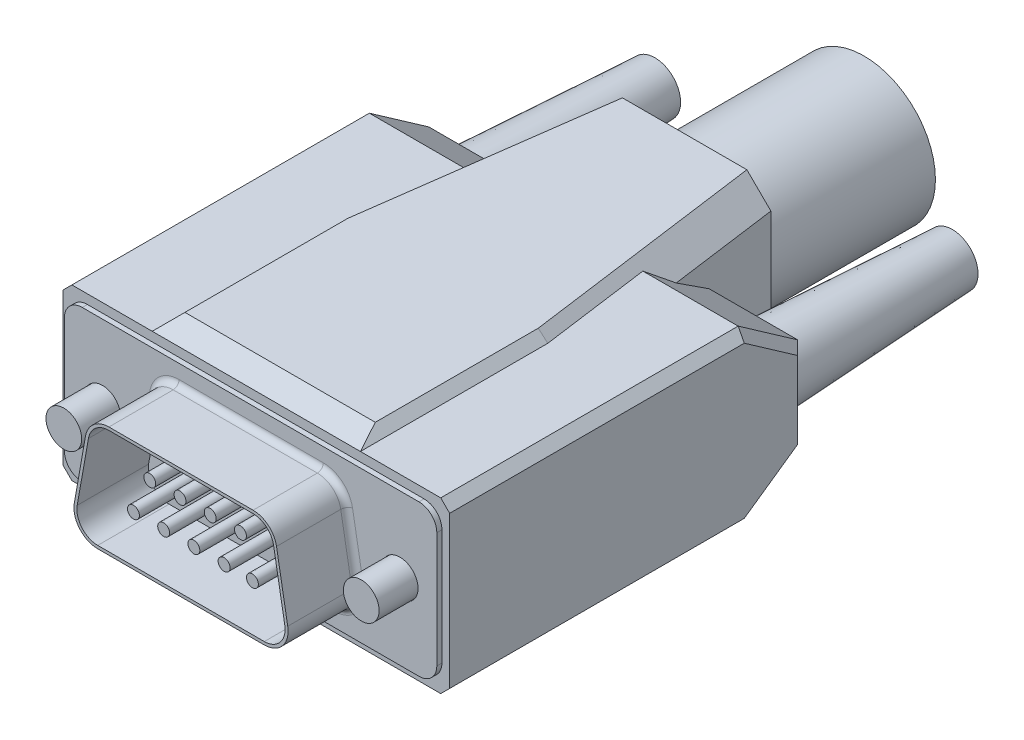
from build123d import *
from OCP.BRepFilletAPI import BRepFilletAPI_MakeChamfer

# Parameters (mm, degrees)
SKETCH1_W                        = 31.3
SKETCH1_H                        = 12.7
SKETCH1_R                        = 1.525
BASE_EXTRUDE_DEPTH               = 0.215
FILLET6_R                        = 1.5
BOSS_EXTRUDE2_DEPTH              = 5.9
FILLET8_R                        = 0.5
CUT_EXTRUDE1_DEPTH               = 6
SKETCH8_R                        = 0.5
BOSS_EXTRUDE3_DEPTH              = 5
LPATTERN1_COUNT                  = 4
LPATTERN1_PITCH                  = 2.54
SKETCH9_W                        = 32.5
SKETCH9_H                        = 14.25
BOSS_EXTRUDE4_DEPTH              = 30
SKETCH11_R                       = 2
CUT_EXTRUDE3_DEPTH               = 20
BOSS_EXTRUDE6_DEPTH              = 6
BOSS_EXTRUDE6_DEPTH_BACK         = 30
SKETCH12_W                       = 17.5
SKETCH12_H                       = 15.75
CHAMFER1_SIZE                    = 5
CHAMFER1_SIZE2                   = 3.5
CHAMFER3_SIZE                    = 11
CHAMFER3_SIZE_2                  = 1.5
CHAMFER4_SIZE                    = 2
CHAMFER6_SIZE                    = 0.75
CHAMFER7_SIZE                    = 0.75
CHAMFER7_SIZE2                   = 2
SKETCH18_R                       = 6
BOSS_EXTRUDE8_DEPTH              = 15.080000066
SKETCH20_R                       = 0.5
BOSS_EXTRUDE10_DEPTH             = 5
SKETCH22_R                       = 2
BOSS_EXTRUDE12_DEPTH             = 2
BOSS_EXTRUDE12_DIRECTION_2_REACH = 42.57
SKETCH21_R                       = 1.5
BOSS_EXTRUDE14_DEPTH             = 3.25
BOSS_EXTRUDE14_DIRECTION_2_REACH = 56.583
SKETCH23_R                       = 3
BOSS_EXTRUDE15_DEPTH             = 16
BOSS_EXTRUDE15_DRAFT             = 3
BOSS_EXTRUDE15_PROFILE_2_DEPTH   = 16
BOSS_EXTRUDE15_PROFILE_2_DRAFT   = 3


# Some blends are built 0.0001 mm under size
with BuildPart() as part:
    # Sketch1 → Base-Extrude (new, symmetric)
    with BuildSketch(Plane.XY):
        with Locations((-0.05, 0)):
            Rectangle(SKETCH1_W, SKETCH1_H)
        with Locations((12.5, 0)):
            Circle(SKETCH1_R, mode=Mode.SUBTRACT)
        with Locations(Location((-12.5, 0, 0), (0, 0, 180))):
            Circle(SKETCH1_R, mode=Mode.SUBTRACT)
    extrude(amount=BASE_EXTRUDE_DEPTH, both=True)

    # Fillet6
    fillet6_edges = [part.edges().sort_by_distance(p)[0] for p in [
        (-15.7, -6.35, 0),
        (15.6, -6.35, 0),
        (15.6, 6.35, 0),
        (-15.7, 6.35, 0),
    ]]
    fillet(fillet6_edges, radius=FILLET6_R)

    # Sketch4 → Boss-Extrude2 (add)
    with BuildSketch(Plane.XY.offset(0.215)):
        with BuildLine():
            Line((7, -4.67), (-7, -4.67))
            ThreePointArc((-7, -4.67), (-8.532088886, -3.955575219), (-8.969615506, -2.322703645))
            Line((-8.969615506, -2.322703645), (-8.028029429, 3.017296355))
            ThreePointArc((-8.028029429, 3.017296355), (-7.343989142, 4.202088886), (-6.058413923, 4.67))
            Line((-6.058413923, 4.67), (6.058413923, 4.67))
            ThreePointArc((6.058413923, 4.67), (7.343989142, 4.202088886), (8.028029429, 3.017296355))
            Line((8.028029429, 3.017296355), (8.969615506, -2.322703645))
            ThreePointArc((8.969615506, -2.322703645), (8.532088886, -3.955575219), (7, -4.67))
        make_face()
    extrude(amount=BOSS_EXTRUDE2_DEPTH)

    # Fillet8
    fillet8_edges = [part.edges().sort_by_distance(p)[0] for p in [
        (-8.532088886, -3.955575219, 0.215),
        (8.498822468, 0.347296355, 0.215),
        (-7.343989142, 4.202088886, 0.215),
        (-8.498822468, 0.347296355, 0.215),
        (0, 4.67, 0.215),
        (7.343989142, 4.202088886, 0.215),
        (8.532088886, -3.955575219, 0.215),
        (0, -4.67, 0.215),
    ]]
    fillet(fillet8_edges, radius=FILLET8_R)

    # Sketch5 → Cut-Extrude1 (cut)
    with BuildSketch(Plane.XY.offset(6.115)):
        with BuildLine():
            Line((-7, -4.42), (7, -4.42))
            ThreePointArc((7, -4.42), (8.340577775, -3.794878317), (8.723413568, -2.366115689))
            Line((8.723413568, -2.366115689), (7.781827491, 2.973884311))
            ThreePointArc((7.781827491, 2.973884311), (7.18329224, 4.010577775), (6.058413923, 4.42))
            Line((6.058413923, 4.42), (-6.058413923, 4.42))
            ThreePointArc((-6.058413923, 4.42), (-7.18329224, 4.010577775), (-7.781827491, 2.973884311))
            Line((-7.781827491, 2.973884311), (-8.723413568, -2.366115689))
            ThreePointArc((-8.723413568, -2.366115689), (-8.340577775, -3.794878317), (-7, -4.42))
        make_face()
    extrude(amount=-CUT_EXTRUDE1_DEPTH, mode=Mode.SUBTRACT)

    # Sketch8 → Boss-Extrude3 (add)
    with BuildSketch(Plane.XY.offset(0.115)):
        with Locations((-5, -1.5)):
            Circle(SKETCH8_R)
        with Locations((-3.625, 1.5)):
            Circle(SKETCH8_R)
    boss_extrude3 = extrude(amount=BOSS_EXTRUDE3_DEPTH)

    # LPattern1: Boss-Extrude3 ×4
    with Locations(*[(i * LPATTERN1_PITCH, 0, 0) for i in range(1, LPATTERN1_COUNT)]):
        add(boss_extrude3)

    # Sketch9 → Boss-Extrude4 (add)
    with BuildSketch(Plane(origin=(0, 0, -0.215), x_dir=(-1, 0, 0), z_dir=(0, 0, -1))):
        Rectangle(SKETCH9_W, SKETCH9_H)
    extrude(amount=BOSS_EXTRUDE4_DEPTH)

    # Sketch11 → Cut-Extrude3 (cut)
    with BuildSketch(Plane(origin=(0, 0, -30.215), x_dir=(-1, 0, 0), z_dir=(0, 0, -1))):
        with Locations((-12.5, 0)):
            Circle(SKETCH11_R)
        with Locations((12.5, 0)):
            Circle(SKETCH11_R)
    extrude(amount=-CUT_EXTRUDE3_DEPTH, mode=Mode.SUBTRACT)

    # Sketch12 → Boss-Extrude6 (add, two sides: drawn at the far end of the back side and taken through both)
    with BuildSketch(Plane(origin=(0, 0, -30.215), x_dir=(-1, 0, 0), z_dir=(0, 0, -1)).offset(-BOSS_EXTRUDE6_DEPTH_BACK)):
        Rectangle(SKETCH12_W, SKETCH12_H)
    extrude(amount=BOSS_EXTRUDE6_DEPTH + BOSS_EXTRUDE6_DEPTH_BACK)

    # Chamfer1: one chamfer whose edges measure the first distance from different faces: ONE call of the kernel's chamfer builder (chamfer() names one face for all edges)
    chamfer1_edges_1 = [part.edges().sort_by_distance(p)[0] for p in [
        (12.5, -7.125, -30.215),
    ]]
    chamfer1_side_1 = [part.faces().sort_by_distance(p)[0] for p in [
        (12.5, -7.125, -15.215),
    ]]
    chamfer1_edges_2 = [part.edges().sort_by_distance(p)[0] for p in [
        (-12.5, 7.125, -30.215),
    ]]
    chamfer1_side_2 = [part.faces().sort_by_distance(p)[0] for p in [
        (-12.5, 7.125, -15.215),
    ]]
    chamfer1_edges_3 = [part.edges().sort_by_distance(p)[0] for p in [
        (-12.5, -7.125, -30.215),
    ]]
    chamfer1_side_3 = [part.faces().sort_by_distance(p)[0] for p in [
        (-12.5, -7.125, -15.215),
    ]]
    chamfer1_edges_4 = [part.edges().sort_by_distance(p)[0] for p in [
        (12.5, 7.125, -30.215),
    ]]
    chamfer1_side_4 = [part.faces().sort_by_distance(p)[0] for p in [
        (12.5, 7.125, -15.215),
    ]]
    chamfer1 = BRepFilletAPI_MakeChamfer(part.part.solid().wrapped)
    for e in chamfer1_edges_1:
        chamfer1.Add(CHAMFER1_SIZE, CHAMFER1_SIZE2, e.wrapped, chamfer1_side_1[0].wrapped)  # the first distance lies on this face
    for e in chamfer1_edges_2:
        chamfer1.Add(CHAMFER1_SIZE, CHAMFER1_SIZE2, e.wrapped, chamfer1_side_2[0].wrapped)  # the first distance lies on this face
    for e in chamfer1_edges_3:
        chamfer1.Add(CHAMFER1_SIZE, CHAMFER1_SIZE2, e.wrapped, chamfer1_side_3[0].wrapped)  # the first distance lies on this face
    for e in chamfer1_edges_4:
        chamfer1.Add(CHAMFER1_SIZE, CHAMFER1_SIZE2, e.wrapped, chamfer1_side_4[0].wrapped)  # the first distance lies on this face
    add(Compound.cast(chamfer1.Shape()), mode=Mode.REPLACE)

    # Chamfer3
    # the kernel refuses this chamfer: 11, 1.5 mm, written as the material it takes off along each edge
    with BuildSketch(Plane(origin=(8.75, -36.465299494, -36.215), x_dir=(0, 0, 1), z_dir=(0, 1, 0))) as chamfer3_piece_1_section:
        Polygon((CHAMFER3_SIZE, 0), (0, -CHAMFER3_SIZE_2), (0, 0), align=None)
    chamfer3_piece_1 = extrude(amount=72.930598988, mode=Mode.PRIVATE)
    chamfer3_piece_1 = split(chamfer3_piece_1, bisect_by=Plane(origin=(8.75, -11.606038089, -18.813517016), z_dir=(0, -0.8192319205190406, -0.5734623443633283)), keep=Keep.TOP, mode=Mode.PRIVATE)
    add(chamfer3_piece_1, mode=Mode.SUBTRACT)
    with BuildSketch(Plane(origin=(8.75, -36.465299494, -36.215), x_dir=(0, 0, 1), z_dir=(0, 1, 0))) as chamfer3_piece_2_section:
        Polygon((CHAMFER3_SIZE, 0), (0, -CHAMFER3_SIZE_2), (0, 0), align=None)
    chamfer3_piece_2 = extrude(amount=72.930598988, mode=Mode.PRIVATE)
    chamfer3_piece_2 = split(chamfer3_piece_2, bisect_by=Plane(origin=(8.75, -36.465299494, -30.215), z_dir=(0, 0, -1)), keep=Keep.TOP, mode=Mode.PRIVATE)
    add(chamfer3_piece_2, mode=Mode.SUBTRACT)
    with BuildSketch(Plane(origin=(8.75, -36.465299494, -36.215), x_dir=(0, 0, 1), z_dir=(0, 1, 0))) as chamfer3_piece_3_section:
        Polygon((CHAMFER3_SIZE, 0), (0, -CHAMFER3_SIZE_2), (0, 0), align=None)
    chamfer3_piece_3 = extrude(amount=72.930598988, mode=Mode.PRIVATE)
    chamfer3_piece_3 = split(chamfer3_piece_3, bisect_by=Plane(origin=(8.75, -12.377850169, -53.076214527), z_dir=(0, 0.8192319205190406, -0.5734623443633283)), keep=Keep.TOP, mode=Mode.PRIVATE)
    add(chamfer3_piece_3, mode=Mode.SUBTRACT)
    with BuildSketch(Plane(origin=(-8.75, 36.465299494, -36.215), x_dir=(1, 0, 0), z_dir=(0, -1, 0))) as chamfer3_piece_4_section:
        Polygon((CHAMFER3_SIZE_2, 0), (0, CHAMFER3_SIZE), (0, 0), align=None)
    chamfer3_piece_4 = extrude(amount=72.930598988, mode=Mode.PRIVATE)
    chamfer3_piece_4 = split(chamfer3_piece_4, bisect_by=Plane(origin=(-8.75, 36.465299494, -30.215), z_dir=(0, 0, -1)), keep=Keep.TOP, mode=Mode.PRIVATE)
    add(chamfer3_piece_4, mode=Mode.SUBTRACT)
    with BuildSketch(Plane(origin=(-8.75, 36.465299494, -36.215), x_dir=(1, 0, 0), z_dir=(0, -1, 0))) as chamfer3_piece_5_section:
        Polygon((CHAMFER3_SIZE_2, 0), (0, CHAMFER3_SIZE), (0, 0), align=None)
    chamfer3_piece_5 = extrude(amount=72.930598988, mode=Mode.PRIVATE)
    chamfer3_piece_5 = split(chamfer3_piece_5, bisect_by=Plane(origin=(-8.75, 11.606038089, -18.813517016), z_dir=(0, 0.8192319205190406, -0.5734623443633283)), keep=Keep.TOP, mode=Mode.PRIVATE)
    add(chamfer3_piece_5, mode=Mode.SUBTRACT)
    with BuildSketch(Plane(origin=(-8.75, 36.465299494, -36.215), x_dir=(1, 0, 0), z_dir=(0, -1, 0))) as chamfer3_piece_6_section:
        Polygon((CHAMFER3_SIZE_2, 0), (0, CHAMFER3_SIZE), (0, 0), align=None)
    chamfer3_piece_6 = extrude(amount=72.930598988, mode=Mode.PRIVATE)
    chamfer3_piece_6 = split(chamfer3_piece_6, bisect_by=Plane(origin=(-8.75, 12.377850169, -53.076214527), z_dir=(0, -0.8192319205190406, -0.5734623443633283)), keep=Keep.TOP, mode=Mode.PRIVATE)
    add(chamfer3_piece_6, mode=Mode.SUBTRACT)

    # Chamfer4
    # the kernel refuses this chamfer: 2 mm, written as the material it takes off along each edge
    with BuildSketch(Plane(origin=(10.83480998, 7.875, -9.926393477), x_dir=(0, -1, 0), z_dir=(-0.1351132047333135, 0, -0.990830168044299))) as chamfer4_piece_1_section:
        Polygon((CHAMFER4_SIZE, 0), (0, CHAMFER4_SIZE), (0, 0), align=None)
    chamfer4_piece_1 = extrude(amount=31.675265559, mode=Mode.PRIVATE)
    chamfer4_piece_1 = split(chamfer4_piece_1, bisect_by=Plane(origin=(10.83480998, 7.125, -9.926393477), z_dir=(0, 1, 0)), keep=Keep.TOP, mode=Mode.PRIVATE)
    add(chamfer4_piece_1, mode=Mode.SUBTRACT)
    with BuildSketch(Plane(origin=(10.83480998, 7.875, -9.926393477), x_dir=(0, -1, 0), z_dir=(-0.1351132047333135, 0, -0.990830168044299))) as chamfer4_piece_2_section:
        Polygon((CHAMFER4_SIZE, 0), (0, CHAMFER4_SIZE), (0, 0), align=None)
    chamfer4_piece_2 = extrude(amount=31.675265559, mode=Mode.PRIVATE)
    chamfer4_piece_2 = split(chamfer4_piece_2, bisect_by=Plane(origin=(10.83480998, 14.554211118, -14.60184126), z_dir=(0, 0.8192319205190406, -0.5734623443633283)), keep=Keep.TOP, mode=Mode.PRIVATE)
    add(chamfer4_piece_2, mode=Mode.SUBTRACT)
    with BuildSketch(Plane(origin=(-6.55506334, 7.875, -41.311202174), x_dir=(0, -1, 0), z_dir=(-0.1351132047333136, 0, 0.990830168044299))) as chamfer4_piece_3_section:
        Polygon((CHAMFER4_SIZE, 0), (0, CHAMFER4_SIZE), (0, 0), align=None)
    chamfer4_piece_3 = extrude(amount=31.675265559, mode=Mode.PRIVATE)
    chamfer4_piece_3 = split(chamfer4_piece_3, bisect_by=Plane(origin=(-6.55506334, -0.190329881, -35.665471258), z_dir=(0, 0.8192319205190406, -0.5734623443633283)), keep=Keep.TOP, mode=Mode.PRIVATE)
    add(chamfer4_piece_3, mode=Mode.SUBTRACT)
    with BuildSketch(Plane(origin=(-6.55506334, 7.875, -41.311202174), x_dir=(0, -1, 0), z_dir=(-0.1351132047333136, 0, 0.990830168044299))) as chamfer4_piece_4_section:
        Polygon((CHAMFER4_SIZE, 0), (0, CHAMFER4_SIZE), (0, 0), align=None)
    chamfer4_piece_4 = extrude(amount=31.675265559, mode=Mode.PRIVATE)
    chamfer4_piece_4 = split(chamfer4_piece_4, bisect_by=Plane(origin=(-6.55506334, 7.125, -41.311202174), z_dir=(0, 1, 0)), keep=Keep.TOP, mode=Mode.PRIVATE)
    add(chamfer4_piece_4, mode=Mode.SUBTRACT)
    with BuildSketch(Plane(origin=(6.55506334, -7.875, -41.311202174), x_dir=(0, 1, 0), z_dir=(0.1351132047333136, 0, 0.990830168044299))) as chamfer4_piece_5_section:
        Polygon((CHAMFER4_SIZE, 0), (0, CHAMFER4_SIZE), (0, 0), align=None)
    chamfer4_piece_5 = extrude(amount=31.675265559, mode=Mode.PRIVATE)
    chamfer4_piece_5 = split(chamfer4_piece_5, bisect_by=Plane(origin=(6.55506334, 0.190329881, -35.665471258), z_dir=(0, -0.8192319205191814, -0.573462344363127)), keep=Keep.TOP, mode=Mode.PRIVATE)
    add(chamfer4_piece_5, mode=Mode.SUBTRACT)
    with BuildSketch(Plane(origin=(6.55506334, -7.875, -41.311202174), x_dir=(0, 1, 0), z_dir=(0.1351132047333136, 0, 0.990830168044299))) as chamfer4_piece_6_section:
        Polygon((CHAMFER4_SIZE, 0), (0, CHAMFER4_SIZE), (0, 0), align=None)
    chamfer4_piece_6 = extrude(amount=31.675265559, mode=Mode.PRIVATE)
    chamfer4_piece_6 = split(chamfer4_piece_6, bisect_by=Plane(origin=(6.55506334, -7.125, -41.311202174), z_dir=(0, -1, 0)), keep=Keep.TOP, mode=Mode.PRIVATE)
    add(chamfer4_piece_6, mode=Mode.SUBTRACT)
    with BuildSketch(Plane(origin=(-10.83480998, -7.875, -9.926393477), x_dir=(0.990830168044299, 0, 0.1351132047333135), z_dir=(0.1351132047333135, 0, -0.990830168044299))) as chamfer4_piece_7_section:
        Polygon((CHAMFER4_SIZE, 0), (0, -CHAMFER4_SIZE), (0, 0), align=None)
    chamfer4_piece_7 = extrude(amount=31.675265559, mode=Mode.PRIVATE)
    chamfer4_piece_7 = split(chamfer4_piece_7, bisect_by=Plane(origin=(-10.83480998, -7.125, -9.926393477), z_dir=(0, -1, 0)), keep=Keep.TOP, mode=Mode.PRIVATE)
    add(chamfer4_piece_7, mode=Mode.SUBTRACT)
    with BuildSketch(Plane(origin=(-10.83480998, -7.875, -9.926393477), x_dir=(0.990830168044299, 0, 0.1351132047333135), z_dir=(0.1351132047333135, 0, -0.990830168044299))) as chamfer4_piece_8_section:
        Polygon((CHAMFER4_SIZE, 0), (0, -CHAMFER4_SIZE), (0, 0), align=None)
    chamfer4_piece_8 = extrude(amount=31.675265559, mode=Mode.PRIVATE)
    chamfer4_piece_8 = split(chamfer4_piece_8, bisect_by=Plane(origin=(-10.83480998, -14.554211118, -14.60184126), z_dir=(0, -0.8192319205190406, -0.5734623443633283)), keep=Keep.TOP, mode=Mode.PRIVATE)
    add(chamfer4_piece_8, mode=Mode.SUBTRACT)

    # Chamfer6
    chamfer6_edges = [part.edges().sort_by_distance(p)[0] for p in [
        (-16.25, 0, -30.215),
        (-16.25, 7.125, -12.715),
        (-16.25, -7.125, -12.715),
        (-16.25, -5.375, -27.715),
        (-16.25, 5.375, -27.715),
        (16.25, 0, -30.215),
        (16.25, -7.125, -12.715),
        (16.25, 7.125, -12.715),
        (16.25, -5.375, -27.715),
        (16.25, 5.375, -27.715),
        (-8.75, 7.875, -5.313798896),
        (8.75, 7.875, -5.313798896),
        (-8.75, -7.875, -5.313798896),
        (8.75, -7.875, -5.313798896),
    ]]
    chamfer(chamfer6_edges, length=CHAMFER6_SIZE - 0.0001)  # a hair under: the kernel refuses the full size

    # Chamfer7
    chamfer7_edges = [part.edges().sort_by_distance(p)[0] for p in [
        (0, 7.875, -0.215),
        (0, -7.875, -0.215),
    ]]
    chamfer7_side = [part.faces().sort_by_distance(p)[0] for p in [
        (15.888847331, 0, -0.215),
    ]]
    chamfer(chamfer7_edges, length=CHAMFER7_SIZE, length2=CHAMFER7_SIZE2, reference=chamfer7_side[0])

    # Sketch18 → Boss-Extrude8 (add)
    with BuildSketch(Plane(origin=(0, 0, -36.215), x_dir=(-1, 0, 0), z_dir=(0, 0, -1))):
        with Locations(Location((0, 0, 0), (0, 0, 180))):
            Circle(SKETCH18_R)
    extrude(amount=BOSS_EXTRUDE8_DEPTH)

    # Sketch20 → Boss-Extrude10 (add)
    with BuildSketch(Plane.XY.offset(0.115)):
        with Locations((5, -1.5)):
            Circle(SKETCH20_R)
    extrude(amount=BOSS_EXTRUDE10_DEPTH)

    # Sketch22 → Boss-Extrude12 (add)
    with BuildSketch(Plane(origin=(0, 0, -30.215), x_dir=(-1, 0, 0), z_dir=(0, 0, -1))):
        with Locations((12.5, 0)):
            Circle(SKETCH22_R)
        with Locations((-12.5, 0)):
            Circle(SKETCH22_R)
    extrude(amount=BOSS_EXTRUDE12_DEPTH)

    # Sketch22 → Boss-Extrude12 direction 2 (add, up to next)
    with BuildSketch(Plane(origin=(0, 0, -30.215), x_dir=(-1, 0, 0), z_dir=(0, 0, -1)), mode=Mode.PRIVATE) as boss_extrude12_direction_2_sk1:
        with Locations((12.5, 0)):
            Circle(SKETCH22_R)
    boss_extrude12_direction_2_tool1 = extrude(boss_extrude12_direction_2_sk1.sketch, amount=-BOSS_EXTRUDE12_DIRECTION_2_REACH, mode=Mode.PRIVATE) - part.part
    # Sketch22 → Boss-Extrude12 direction 2 (add, up to next)
    with BuildSketch(Plane(origin=(0, 0, -30.215), x_dir=(-1, 0, 0), z_dir=(0, 0, -1)), mode=Mode.PRIVATE) as boss_extrude12_direction_2_sk2:
        with Locations((-12.5, 0)):
            Circle(SKETCH22_R)
    boss_extrude12_direction_2_tool2 = extrude(boss_extrude12_direction_2_sk2.sketch, amount=-BOSS_EXTRUDE12_DIRECTION_2_REACH, mode=Mode.PRIVATE) - part.part
    add(boss_extrude12_direction_2_tool1.solids().sort_by_distance((-12.5, 0, -30.215))[0])
    add(boss_extrude12_direction_2_tool2.solids().sort_by_distance((12.5, 0, -30.215))[0])

    # Sketch21 → Boss-Extrude14 (add)
    with BuildSketch(Plane.XY.offset(0.215)):
        with Locations((-12.5, 0)):
            Circle(SKETCH21_R)
        with Locations((12.5, 0)):
            Circle(SKETCH21_R)
    extrude(amount=BOSS_EXTRUDE14_DEPTH)

    # Sketch21 → Boss-Extrude14 direction 2 (add, up to next)
    with BuildSketch(Plane.XY.offset(0.215), mode=Mode.PRIVATE) as boss_extrude14_direction_2_sk1:
        with Locations((-12.5, 0)):
            Circle(SKETCH21_R)
    boss_extrude14_direction_2_tool1 = extrude(boss_extrude14_direction_2_sk1.sketch, amount=-BOSS_EXTRUDE14_DIRECTION_2_REACH, mode=Mode.PRIVATE) - part.part
    # Sketch21 → Boss-Extrude14 direction 2 (add, up to next)
    with BuildSketch(Plane.XY.offset(0.215), mode=Mode.PRIVATE) as boss_extrude14_direction_2_sk2:
        with Locations((12.5, 0)):
            Circle(SKETCH21_R)
    boss_extrude14_direction_2_tool2 = extrude(boss_extrude14_direction_2_sk2.sketch, amount=-BOSS_EXTRUDE14_DIRECTION_2_REACH, mode=Mode.PRIVATE) - part.part
    add(boss_extrude14_direction_2_tool1.solids().sort_by_distance((-12.5, 0, 0.215))[0])
    add(boss_extrude14_direction_2_tool2.solids().sort_by_distance((12.5, 0, 0.215))[0])


with BuildPart() as boss_extrude15_tool:
    # Sketch23 → Boss-Extrude15 (with draft: the straight prism first)
    with BuildSketch(Plane(origin=(0, 0, -30.215), x_dir=(-1, 0, 0), z_dir=(0, 0, -1))):
        with Locations((12.5, 0)):
            Circle(SKETCH23_R)
    extrude(amount=BOSS_EXTRUDE15_DEPTH)
    # Boss-Extrude15: the draft: its side faces are tilted about the plane it starts from
    boss_extrude15_sides = [boss_extrude15_tool.faces().sort_by_distance(p)[0] for p in [
        (-9.5, 0, -38.215),
    ]]
    draft(boss_extrude15_sides, Plane(origin=(0, 0, -30.215), x_dir=(-1, 0, 0), z_dir=(0, 0, -1)), BOSS_EXTRUDE15_DRAFT)


with BuildPart() as part_1:
    add(part.part)

    # Boss-Extrude15: add boss_extrude15_tool
    add(boss_extrude15_tool.part)


with BuildPart() as boss_extrude15_profile_2_tool:
    # Sketch23 → Boss-Extrude15 profile 2 (with draft: the straight prism first)
    with BuildSketch(Plane(origin=(0, 0, -30.215), x_dir=(-1, 0, 0), z_dir=(0, 0, -1))):
        with Locations((-12.5, 0)):
            Circle(SKETCH23_R)
    extrude(amount=BOSS_EXTRUDE15_PROFILE_2_DEPTH)
    # Boss-Extrude15 profile 2: the draft: its side faces are tilted about the plane it starts from
    boss_extrude15_profile_2_sides = [boss_extrude15_profile_2_tool.faces().sort_by_distance(p)[0] for p in [
        (15.5, 0, -38.215),
    ]]
    draft(boss_extrude15_profile_2_sides, Plane(origin=(0, 0, -30.215), x_dir=(-1, 0, 0), z_dir=(0, 0, -1)), BOSS_EXTRUDE15_PROFILE_2_DRAFT)


with BuildPart() as part_2:
    add(part_1.part)

    # Boss-Extrude15 profile 2: add boss_extrude15_profile_2_tool
    add(boss_extrude15_profile_2_tool.part)


solid = part_2.part
